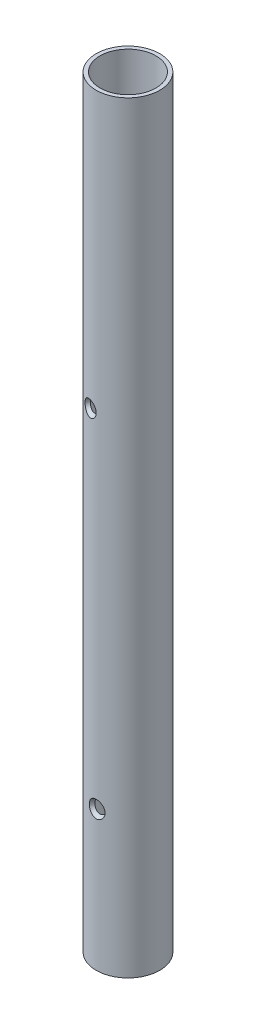
from build123d import *

# Parameters (mm, degrees)
SKETCH1_R           = 25
SKETCH1_R_2         = 22
BOSS_EXTRUDE1_DEPTH = 600


with BuildPart() as part:
    # Sketch1 → Boss-Extrude1 (new body)
    with BuildSketch(Plane(origin=(0, 0, 0), x_dir=(1, 0, 0), z_dir=(0, 1, 0))):
        Circle(SKETCH1_R)
        Circle(SKETCH1_R_2, mode=Mode.SUBTRACT)
    extrude(amount=BOSS_EXTRUDE1_DEPTH)

    # Sketch4 → Cut-Revolve3 (revolve, cut)
    with BuildSketch(Plane(origin=(-103.136389545, 380, -329.994936254), x_dir=(-1, 0, 0), z_dir=(0, -1, 0))):
        Polygon((-96.496861449, -304.994936254), (-96.496861449, -316.494936254), (-103.136389545, -304.994936254), align=None)
    cut_revolve3 = revolve(axis=Axis((-6.639528096, 380, -25), (0, 0, 1)), mode=Mode.SUBTRACT)

    # Sketch5 → Cut-Revolve4 (revolve, cut)
    with BuildSketch(Plane(origin=(-103.136389545, 110, -329.994936254), x_dir=(-1, 0, 0), z_dir=(0, -1, 0))):
        Polygon((-103.136389545, -304.994936254), (-103.136389545, -316.494936254), (-96.496861449, -304.994936254), align=None)
    cut_revolve4 = revolve(axis=Axis((0, 110, -25), (0, 0, 1)), mode=Mode.SUBTRACT)

    # Mirror3: Cut-Revolve3, Cut-Revolve4 across plane
    add(cut_revolve3.mirror(Plane.XY), mode=Mode.SUBTRACT)
    add(cut_revolve4.mirror(Plane.XY), mode=Mode.SUBTRACT)


solid = part.part
